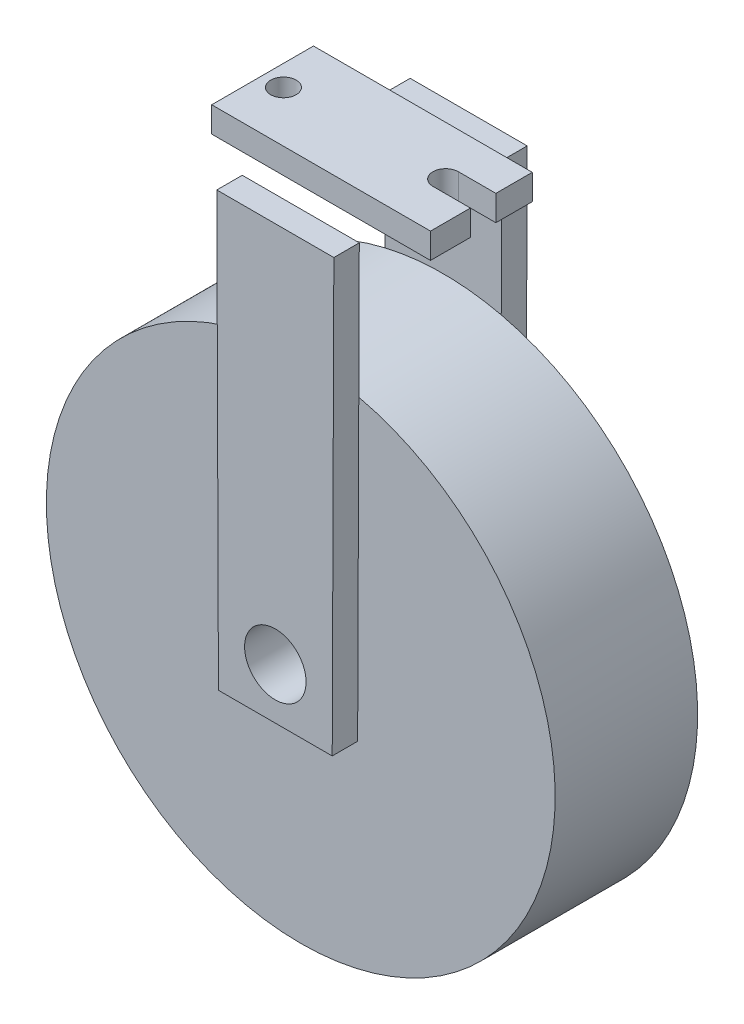
from build123d import *

# Parameters (mm, degrees)
SKETCH_1_R             = 2.5
EXTRUDE_1_DEPTH        = 5
EXTRUDE_START          = -14
SKETCH_2_R             = 50
EXTRUDE_2_DEPTH        = 28
EXTRUDE_3_DEPTH        = 5
PATTERN_LINEAR_1_COUNT = 2
PATTERN_LINEAR_1_PITCH = 33
SKETCH_4_R             = 6.044924725
CUT_EXTRUDE_1_DEPTH    = 140.889241902


with BuildPart() as part:
    # Эскиз1 → Бобышка-Вытянуть1 (new body)
    with BuildSketch(Plane(origin=(0, 0, 0), x_dir=(1, 0, 0), z_dir=(0, 1, 0))):
        with BuildLine():
            Line((14.12917906, 2.843570301), (21.5, 2.843570301))
            Line((21.5, 2.843570301), (21.5, 10))
            Line((21.5, 10), (-21.5, 10))
            Line((-21.5, 10), (-21.5, -10))
            Line((-21.5, -10), (21.5, -10))
            Line((21.5, -10), (21.5, -2.156429699))
            Line((21.5, -2.156429699), (14.12917906, -2.156429699))
            ThreePointArc((14.12917906, -2.156429699), (11.62917906, 0.343570301), (14.12917906, 2.843570301))
        make_face()
        with Locations((-17.406134819, 0)):
            Circle(SKETCH_1_R, mode=Mode.SUBTRACT)
    extrude(amount=EXTRUDE_1_DEPTH)


with BuildPart() as body_2:
    # Эскиз2 → Бобышка-Вытянуть2 (new body)
    with BuildSketch(Plane.XY.offset(EXTRUDE_START)):
        with Locations((0, -75)):
            Circle(SKETCH_2_R)
    extrude(amount=EXTRUDE_2_DEPTH)

    # Эскиз3 → Бобышка-Вытянуть3 (add)
    with BuildSketch(Plane.XY.offset(14)):
        Polygon((-11.180339887, -85), (11.180339887, -85), (11.5, 0), (-11.5, 0), align=None)
    extrude_3 = extrude(amount=EXTRUDE_3_DEPTH)

    # Линейный массив1: Бобышка-Вытянуть3 ×2
    with Locations(*[(0, 0, -i * PATTERN_LINEAR_1_PITCH) for i in range(1, PATTERN_LINEAR_1_COUNT)]):
        add(extrude_3)

    # Эскиз4 → Вырез-Вытянуть1 (cut, through all)
    with BuildSketch(Plane(origin=(0, 0, -19), x_dir=(-1, 0, 0), z_dir=(0, 0, -1))):
        with Locations((0, -75)):
            Circle(SKETCH_4_R)
    extrude(amount=-CUT_EXTRUDE_1_DEPTH, mode=Mode.SUBTRACT)


solid = Compound([part.part, body_2.part])
